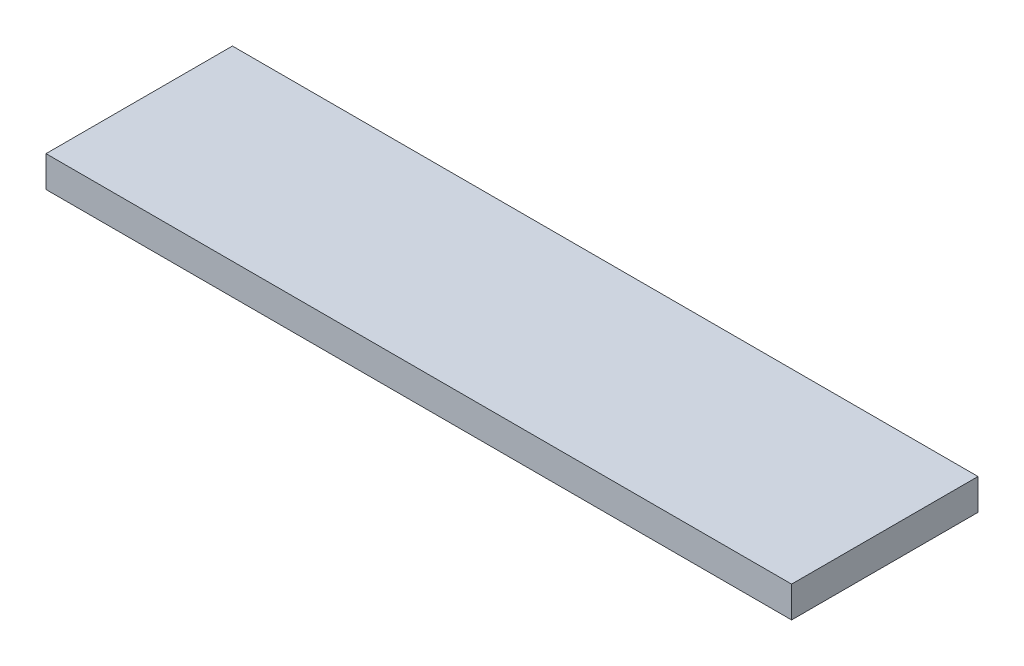
from build123d import *

# Parameters (mm, degrees)
SKETCH_2_W      = 480
SKETCH_2_H      = 120
EXTRUDE_1_DEPTH = 20


with BuildPart() as part:
    # Эскиз2 → Бобышка-Вытянуть1 (new body)
    with BuildSketch(Plane(origin=(0, 0, 0), x_dir=(1, 0, 0), z_dir=(0, 1, 0))):
        Rectangle(SKETCH_2_W, SKETCH_2_H)
    extrude(amount=EXTRUDE_1_DEPTH)


solid = part.part
